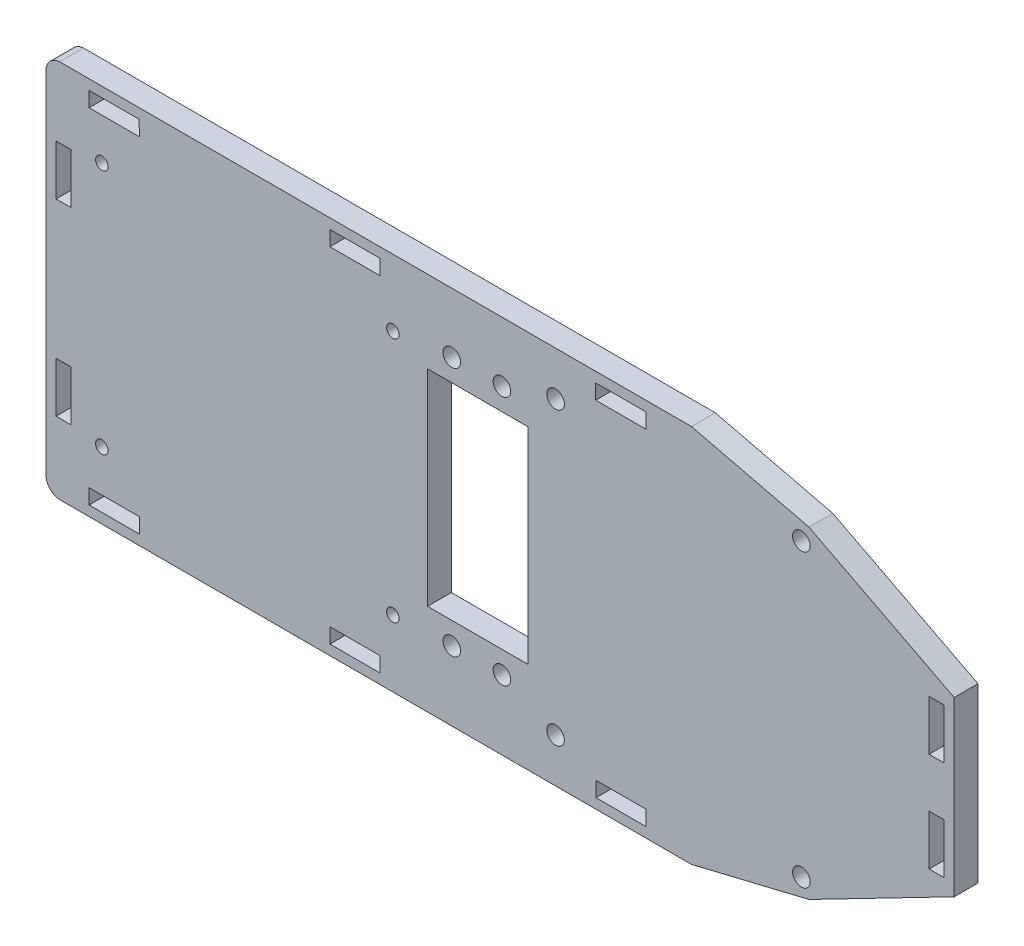
from build123d import *

# Parameters (mm, degrees)
SKETCH1_W           = 181
SKETCH1_H           = 75.57
BOSS_EXTRUDE2_DEPTH = 4.75
SKETCH6_W           = 3
SKETCH6_H           = 10
SKETCH6_W_2         = 10
SKETCH6_H_2         = 2.996296141
SKETCH6_W_3         = 9.939831887
SKETCH6_H_3         = 3
SKETCH6_W_4         = 20
SKETCH6_H_4         = 41
SKETCH6_R           = 1.75
SKETCH6_R_2         = 1.25
CUT_EXTRUDE7_DEPTH  = 9


with BuildPart() as part:
    # Sketch1 → Boss-Extrude2 (new body)
    with BuildSketch(Plane.XY):
        Rectangle(SKETCH1_W, SKETCH1_H)
    extrude(amount=BOSS_EXTRUDE2_DEPTH)

    # Sketch6 → Cut-Extrude7 (cut)
    with BuildSketch(Plane.XY.offset(4.75)):
        with BuildLine():
            Line((-90.5, 37.785), (-90.5, 35.274795088))
            ThreePointArc((-90.5, 35.274795088), (-89.587457665, 37.010103297), (-87.786468161, 37.785))
            Line((-87.786468161, 37.785), (-90.5, 37.785))
        make_face()
        with BuildLine():
            ThreePointArc((-87.786468161, -37.785), (-89.587457665, -37.010103297), (-90.5, -35.274795088))
            Line((-90.5, -35.274795088), (-90.5, -37.785))
            Line((-90.5, -37.785), (-87.786468161, -37.785))
        make_face()
        Polygon((90.5, 37.785), (38.141923512, 37.785), (61.552812751, 32.14), (90.5, 17.2), align=None)
        Polygon((61.552812751, -32.135214744), (38.141923512, -37.785), (90.5, -37.785), (90.5, -17.2), align=None)
        Polygon((-81.947178372, 35.785), (-81.913405317, 32.785953243), (-71.879658735, 32.785762546), (-71.94729523, 35.785), align=None)
        with Locations((-87, 18.75)):
            Rectangle(SKETCH6_W, SKETCH6_H)
        with Locations((-87, -18.75)):
            Rectangle(SKETCH6_W, SKETCH6_H)
        Polygon((-33.930858677, 35.785), (-33.929672617, 32.785000234), (-23.927298062, 32.788706115), (-23.930975535, 35.785), align=None)
        Polygon((-71.879658735, -32.785190697), (-81.913405317, -32.785000001), (-81.913478974, -35.785), (-71.913483982, -35.785), align=None)
        Polygon((-33.903748919, -32.785912448), (-33.902562858, -35.785912214), (-23.88684069, -35.786102825), (-23.88684069, -32.786102825), align=None)
        with Locations((87, 9.9)):
            Rectangle(SKETCH6_W, SKETCH6_H)
        with Locations((24.052991197, 34.28685193)):
            Rectangle(SKETCH6_W_2, SKETCH6_H_2)
        with Locations((24.083075253, -34.285)):
            Rectangle(SKETCH6_W_3, SKETCH6_H_3)
        with Locations((-4.459374015, 0.957016564)):
            Rectangle(SKETCH6_W_4, SKETCH6_H_4)
        with Locations((87, -9.9)):
            Rectangle(SKETCH6_W, SKETCH6_H)
        with Locations((-9.629374015, 25.857016564)):
            Circle(SKETCH6_R)
        with Locations((0.370625985, 25.857016564)):
            Circle(SKETCH6_R)
        with Locations((0.370625985, -23.942983436)):
            Circle(SKETCH6_R)
        with Locations((-9.629374015, -23.942983436)):
            Circle(SKETCH6_R)
        with Locations((11.052985258, -29)):
            Circle(SKETCH6_R)
        with Locations((11.052985258, 29)):
            Circle(SKETCH6_R)
        with Locations((60.052985258, -29)):
            Circle(SKETCH6_R)
        with Locations((60.052985258, 29)):
            Circle(SKETCH6_R)
        with Locations((-79.373192673, 24.5)):
            Circle(SKETCH6_R_2)
        with Locations((-79.373192673, -24.5)):
            Circle(SKETCH6_R_2)
        with Locations((-21.373192673, -24.5)):
            Circle(SKETCH6_R_2)
        with Locations((-21.373192673, 24.5)):
            Circle(SKETCH6_R_2)
    extrude(amount=-CUT_EXTRUDE7_DEPTH, mode=Mode.SUBTRACT)


solid = part.part
